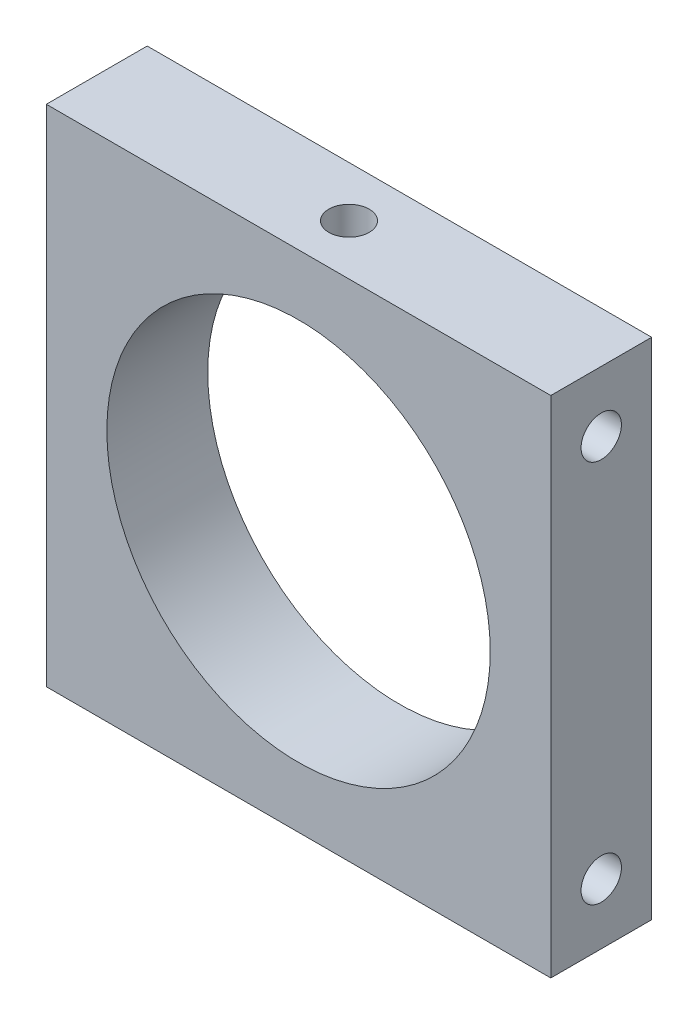
from build123d import *

# Parameters (mm, degrees)
ESQUISSE1_W             = 25
ESQUISSE1_H             = 25
ESQUISSE1_R             = 9.5
BOSS_EXTRU_1_DEPTH      = 5
ESQUISSE2_R             = 1
ENL_V_MAT_EXTRU_1_DEPTH = 2
ENL_V_START             = -2
ESQUISSE3_R             = 1
ENL_V_MAT_EXTRU_2_DEPTH = 2
ENL_V_MAT_EXTRU_3_REACH = 47.825
ESQUISSE4_R             = 1


with BuildPart() as part:
    # Esquisse1 → Boss.-Extru.1 (new body)
    with BuildSketch(Plane.XY):
        with Locations((-25.578340105, 2.233717901)):
            Rectangle(ESQUISSE1_W, ESQUISSE1_H)
        with Locations((-25.578340105, 2.233717901)):
            Circle(ESQUISSE1_R, mode=Mode.SUBTRACT)
    extrude(amount=BOSS_EXTRU_1_DEPTH)

    # Esquisse2 → Enlèv. mat.-Extru.1 (cut)
    with BuildSketch(Plane.ZY.offset(38.078340105)):
        with Locations((2.5, 11.733717901)):
            Circle(ESQUISSE2_R)
        with Locations((2.5, -7.266282099)):
            Circle(ESQUISSE2_R)
    extrude(amount=-ENL_V_MAT_EXTRU_1_DEPTH, mode=Mode.SUBTRACT)

    # Esquisse3 → Enlèv. mat.-Extru.2 (cut)
    with BuildSketch(Plane(origin=(-13.078340105, 0, 0), x_dir=(0, 0, -1), z_dir=(1, 0, 0)).offset(ENL_V_START)):
        with Locations((-2.5, -7.266282099)):
            Circle(ESQUISSE3_R)
        with Locations((-2.5, 11.733717901)):
            Circle(ESQUISSE3_R)
    extrude(amount=ENL_V_MAT_EXTRU_2_DEPTH, mode=Mode.SUBTRACT)

    # Esquisse4 → Enlèv. mat.-Extru.3 (cut, up to next)
    with BuildSketch(Plane(origin=(0, 14.733717901, 0), x_dir=(1, 0, 0), z_dir=(0, 1, 0)), mode=Mode.PRIVATE) as enl_v_mat_extru_3_sk1:
        with Locations((-25.578340105, -2.5)):
            Circle(ESQUISSE4_R)
    enl_v_mat_extru_3_tool1 = extrude(enl_v_mat_extru_3_sk1.sketch, amount=-ENL_V_MAT_EXTRU_3_REACH, mode=Mode.PRIVATE) & part.part
    add(enl_v_mat_extru_3_tool1.solids().sort_by_distance((-25.57834, 14.733718, 2.5))[0], mode=Mode.SUBTRACT)


solid = part.part
